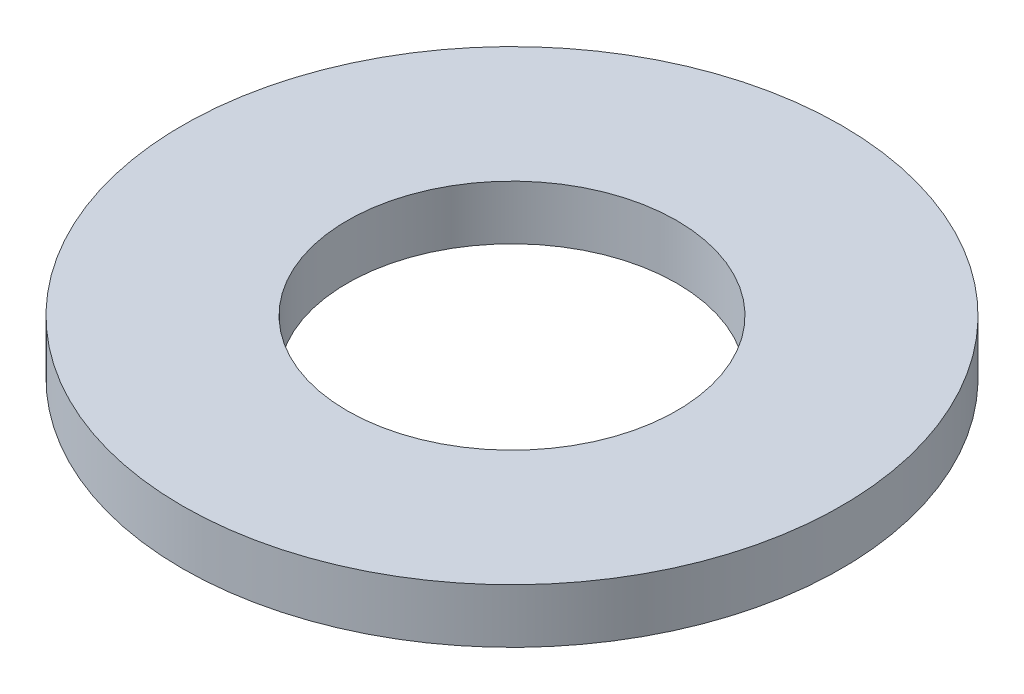
from build123d import *

# Parameters (mm, degrees)
SKETCH1_R           = 85
BOSS_EXTRUDE1_DEPTH = 14
SKETCH2_R           = 42.5
CUT_EXTRUDE1_DEPTH  = 122.020659393


with BuildPart() as part:
    # Sketch1 → Boss-Extrude1 (new body)
    with BuildSketch(Plane(origin=(0, 0, 0), x_dir=(1, 0, 0), z_dir=(0, 1, 0))):
        Circle(SKETCH1_R)
    extrude(amount=BOSS_EXTRUDE1_DEPTH)

    # Sketch2 → Cut-Extrude1 (cut, through all)
    with BuildSketch(Plane(origin=(0, 0, 0), x_dir=(1, 0, 0), z_dir=(0, 1, 0))):
        Circle(SKETCH2_R)
    extrude(amount=CUT_EXTRUDE1_DEPTH, mode=Mode.SUBTRACT)


solid = part.part
